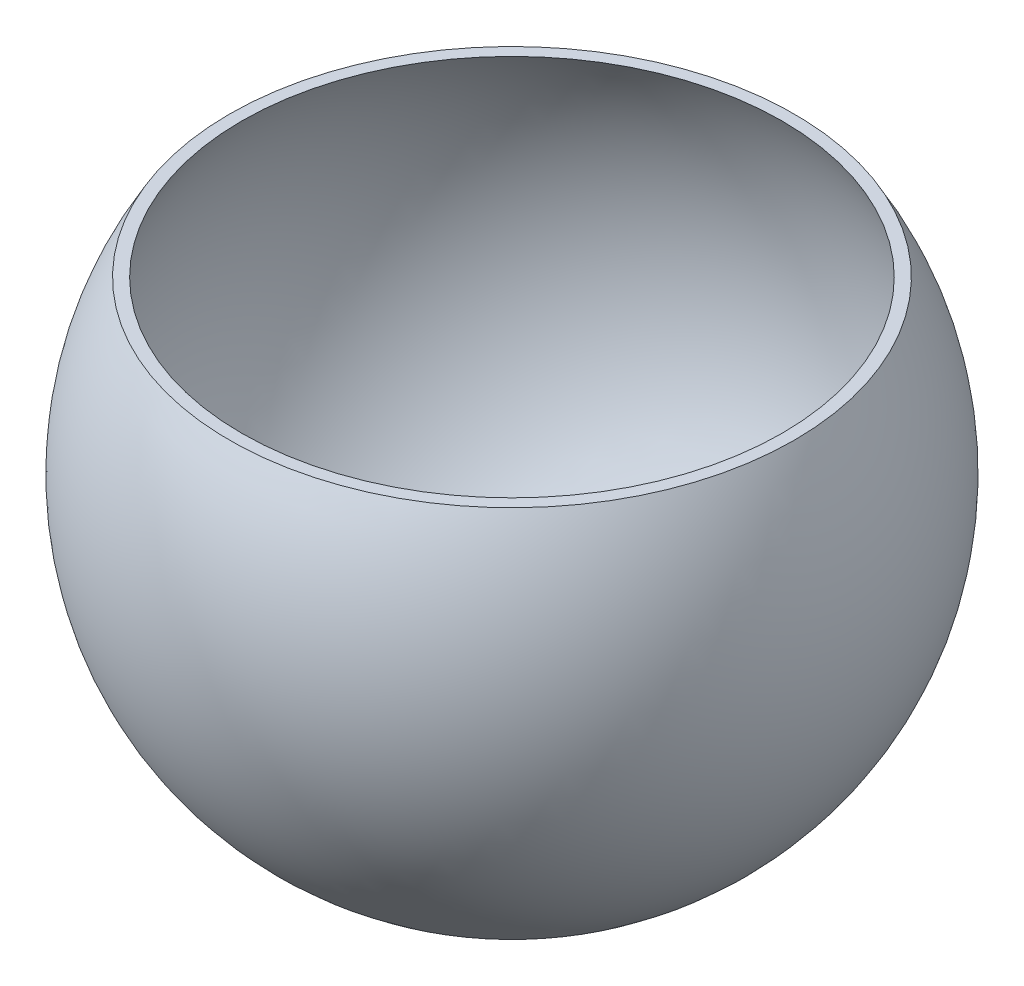
from build123d import *


with BuildPart() as part:
    # Sketch1 → Revolve1 (revolve)
    with BuildSketch(Plane.XY):
        with BuildLine():
            Line((174.101233777, 186.083659956), (166.646098372, 186.083659956))
            ThreePointArc((166.646098372, 186.083659956), (172.302072359, -13.891174215), (0, -115.547065358))
            Line((0, -115.547065358), (0, -121.897065358))
            ThreePointArc((0, -121.897065358), (176.892175327, -18.694056853), (174.101233777, 186.083659956))
        make_face()
    revolve(axis=Axis((0, 0, 0), (0, -1, 0)))


solid = part.part
